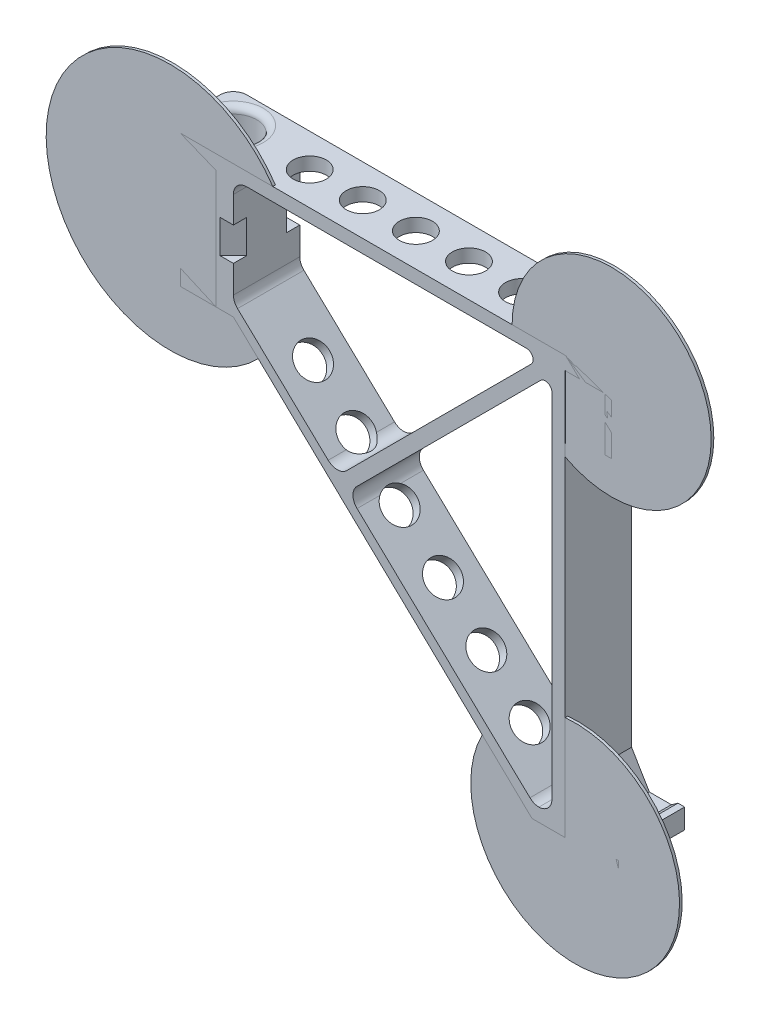
from build123d import *

# Parameters (mm, degrees)
FRAME_DEPTH         = 10
SKETCH13_R          = 3.5
CUT_EXTRUDE7_DEPTH  = 67.66634461
FILLET4_R           = 1
SKETCH14_W          = 5
SKETCH14_H          = 5
CUT_EXTRUDE8_DEPTH  = 81.777611378
FILLET5_R           = 2
CUT_EXTRUDE9_DEPTH  = 5
CHAMFER1_SIZE       = 1
FILLET6_R           = 2
FILLET7_R           = 1
CUT_EXTRUDE11_REACH = 59.656
SKETCH18_R          = 2.5
CUT_EXTRUDE12_REACH = 83.008
SKETCH19_R          = 2.5
EARS_DEPTH          = 0.4
EARS_2_DEPTH        = 0.4
EARS_3_DEPTH        = 0.4


with BuildPart() as part:
    # Sketch1 → Frame (new body)
    with BuildSketch(Plane.XY):
        Polygon((-8, 62.65), (49, 62.65), (49, 52.65), (48, 52.65), (48, 60.65), (42, 60.65), (42, 6.5), (44.7, 2), (48, 2), (49, 2.703504174), (50, 2.703504174), (50, -0.296495826), (37, -0.296495826), (-8, 42.65), (-18, 42.65), (-18, 62.65), align=None)
        Polygon((-8, 44.65), (-8, 60.65), (38.585786438, 60.65), (7.695355997, 29.759569559), align=None, mode=Mode.SUBTRACT)
        Polygon((40, 59.235786438), (40, 1.703504174), (37.268035971, 1.703504174), (9.146787391, 28.382573828), align=None, mode=Mode.SUBTRACT)
    extrude(amount=FRAME_DEPTH)

    # Sketch13 → Cut-Extrude7 (cut, through all)
    with BuildSketch(Plane.XZ.offset(-42.65)):
        with Locations(Location((-13, 5, 0), (0, 0, 270))):
            Circle(SKETCH13_R)
    extrude(amount=-CUT_EXTRUDE7_DEPTH, mode=Mode.SUBTRACT)

    # Fillet4
    fillet4_edges = [part.edges().sort_by_distance(p)[0] for p in [
        (-13, 62.65, 8.5),
        (-13, 42.65, 8.5),
    ]]
    fillet(fillet4_edges, radius=FILLET4_R)

    # Sketch14 → Cut-Extrude8 (cut, through all)
    with BuildSketch(Plane.XY.offset(10)):
        with Locations((-15.5, 52.15)):
            Rectangle(SKETCH14_W, SKETCH14_H)
    extrude(amount=-CUT_EXTRUDE8_DEPTH, mode=Mode.SUBTRACT)

    # Fillet5
    fillet5_edges = [part.edges().sort_by_distance(p)[0] for p in [
        (-18, 58.65, 0),
        (-18, 58.65, 10),
        (-18, 46.15, 0),
        (-18, 46.15, 10),
    ]]
    fillet(fillet5_edges, radius=FILLET5_R)

    # Sketch15 → Cut-Extrude9 (cut)
    with BuildSketch(Plane(origin=(0, 49.65, 0), x_dir=(1, 0, 0), z_dir=(0, 1, 0))):
        Polygon((-10, 0), (-8, -2), (-8, 0), align=None)
        Polygon((-10, -10), (-8, -8), (-8, -10), align=None)
    extrude(amount=CUT_EXTRUDE9_DEPTH, mode=Mode.SUBTRACT)

    # Chamfer1
    chamfer1_edges = [part.edges().sort_by_distance(p)[0] for p in [
        (-13, 52.15, 0),
        (-13, 52.15, 10),
    ]]
    chamfer(chamfer1_edges, length=CHAMFER1_SIZE)

    # Fillet6
    # the kernel refuses this fillet: 2 mm, written as the material it adds along each edge
    with BuildSketch(Plane(origin=(-8, 60.65, 0), x_dir=(0, -1, 0), z_dir=(0, 0, 1)), Plane(origin=(40, 1.703504174, 0), x_dir=(0, 1, 0), z_dir=(0, 0, 1))) as fillet6_piece_1:
        with BuildLine():
            CenterArc((FILLET6_R, FILLET6_R), FILLET6_R, 180, 90)
            Line((0, FILLET6_R), (0, 0))
            Line((0, 0), (FILLET6_R, 0))
        make_face()
    extrude(amount=10)
    with BuildSketch(Plane(origin=(37.268035971, 1.703504174, 0), x_dir=(1, 0, 0), z_dir=(0, 0, 1))) as fillet6_piece_2:
        with BuildLine():
            CenterArc((FILLET6_R * 0.398883640348, FILLET6_R), FILLET6_R, 226.507503973, 43.492496027)
            Line((-FILLET6_R * 0.289375927855, FILLET6_R * 0.274535482069), (0, 0))
            Line((0, 0), (FILLET6_R * 0.398883640348, 0))
        make_face()
    extrude(amount=10)
    with BuildSketch(Plane(origin=(-8, 44.65, 0), x_dir=(0, 1, 0), z_dir=(0, 0, 1))) as fillet6_piece_3:
        with BuildLine():
            CenterArc((FILLET6_R * 0.429711480151, -FILLET6_R), FILLET6_R, 90, 46.507503973)
            Line((-FILLET6_R * 0.29575303778, -FILLET6_R * 0.311740431797), (0, 0))
            Line((0, 0), (FILLET6_R * 0.429711480151, 0))
        make_face()
    extrude(amount=10)
    with BuildSketch(Plane(origin=(9.146787391, 28.382573828, 0), x_dir=(0.7254645179309741, -0.6882595682031448, 0), z_dir=(0, 0, 1))) as fillet6_piece_4:
        with BuildLine():
            CenterArc((FILLET6_R * 1.02666321267, FILLET6_R), FILLET6_R, 178.492496027, 91.507503973)
            Line((FILLET6_R * 0.0270093246389, FILLET6_R * 1.02630787225), (0, 0))
            Line((0, 0), (FILLET6_R * 1.02666321267, 0))
        make_face()
    extrude(amount=10)
    with BuildSketch(Plane(origin=(7.695355997, 29.759569559, 0), x_dir=(0.7071067811865478, 0.7071067811865474, 0), z_dir=(0, 0, 1))) as fillet6_piece_5:
        with BuildLine():
            CenterArc((FILLET6_R * 0.974029250934, FILLET6_R), FILLET6_R, 181.507503973, 88.492496027)
            Line((-FILLET6_R * 0.0256246370977, FILLET6_R * 0.973692127754), (0, 0))
            Line((0, 0), (FILLET6_R * 0.974029250934, 0))
        make_face()
    extrude(amount=10)

    # Fillet7
    fillet7_edges = [part.edges().sort_by_distance(p)[0] for p in [
        (38.585786438, 60.65, 5),
        (40, 59.235786438, 5),
    ]]
    fillet(fillet7_edges, radius=FILLET7_R)

    # Sketch18 → Cut-Extrude11 (cut, up to next)
    with BuildSketch(Plane(origin=(17.488453969, 18.324671512, 0), x_dir=(0.7234201739583832, -0.6904080329124386, 0), z_dir=(-0.6904080329124386, -0.7234201739583832, 0)), mode=Mode.PRIVATE) as cut_extrude11_sk1:
        with Locations((-26.968990252, 5)):
            Circle(SKETCH18_R)
    cut_extrude11_tool1 = extrude(cut_extrude11_sk1.sketch, amount=-CUT_EXTRUDE11_REACH, mode=Mode.PRIVATE) & part.part
    # Sketch18 → Cut-Extrude11 (cut, up to next)
    with BuildSketch(Plane(origin=(17.488453969, 18.324671512, 0), x_dir=(0.7234201739583832, -0.6904080329124386, 0), z_dir=(-0.6904080329124386, -0.7234201739583832, 0)), mode=Mode.PRIVATE) as cut_extrude11_sk2:
        with Locations((-17.968990252, 5)):
            Circle(SKETCH18_R)
    cut_extrude11_tool2 = extrude(cut_extrude11_sk2.sketch, amount=-CUT_EXTRUDE11_REACH, mode=Mode.PRIVATE) & part.part
    # Sketch18 → Cut-Extrude11 (cut, up to next)
    with BuildSketch(Plane(origin=(17.488453969, 18.324671512, 0), x_dir=(0.7234201739583832, -0.6904080329124386, 0), z_dir=(-0.6904080329124386, -0.7234201739583832, 0)), mode=Mode.PRIVATE) as cut_extrude11_sk3:
        with Locations((-8.968990252, 5)):
            Circle(SKETCH18_R)
    cut_extrude11_tool3 = extrude(cut_extrude11_sk3.sketch, amount=-CUT_EXTRUDE11_REACH, mode=Mode.PRIVATE) & part.part
    # Sketch18 → Cut-Extrude11 (cut, up to next)
    with BuildSketch(Plane(origin=(17.488453969, 18.324671512, 0), x_dir=(0.7234201739583832, -0.6904080329124386, 0), z_dir=(-0.6904080329124386, -0.7234201739583832, 0)), mode=Mode.PRIVATE) as cut_extrude11_sk4:
        with Locations((0.031009748, 5)):
            Circle(SKETCH18_R)
    cut_extrude11_tool4 = extrude(cut_extrude11_sk4.sketch, amount=-CUT_EXTRUDE11_REACH, mode=Mode.PRIVATE) & part.part
    # Sketch18 → Cut-Extrude11 (cut, up to next)
    with BuildSketch(Plane(origin=(17.488453969, 18.324671512, 0), x_dir=(0.7234201739583832, -0.6904080329124386, 0), z_dir=(-0.6904080329124386, -0.7234201739583832, 0)), mode=Mode.PRIVATE) as cut_extrude11_sk5:
        with Locations((9.031009748, 5)):
            Circle(SKETCH18_R)
    cut_extrude11_tool5 = extrude(cut_extrude11_sk5.sketch, amount=-CUT_EXTRUDE11_REACH, mode=Mode.PRIVATE) & part.part
    # Sketch18 → Cut-Extrude11 (cut, up to next)
    with BuildSketch(Plane(origin=(17.488453969, 18.324671512, 0), x_dir=(0.7234201739583832, -0.6904080329124386, 0), z_dir=(-0.6904080329124386, -0.7234201739583832, 0)), mode=Mode.PRIVATE) as cut_extrude11_sk6:
        with Locations((18.031009748, 5)):
            Circle(SKETCH18_R)
    cut_extrude11_tool6 = extrude(cut_extrude11_sk6.sketch, amount=-CUT_EXTRUDE11_REACH, mode=Mode.PRIVATE) & part.part
    add(cut_extrude11_tool1.solids().sort_by_distance((-2.021458, 36.944279, 5))[0], mode=Mode.SUBTRACT)
    add(cut_extrude11_tool2.solids().sort_by_distance((4.489324, 30.730607, 5))[0], mode=Mode.SUBTRACT)
    add(cut_extrude11_tool3.solids().sort_by_distance((11.000105, 24.516934, 5))[0], mode=Mode.SUBTRACT)
    add(cut_extrude11_tool4.solids().sort_by_distance((17.510887, 18.303262, 5))[0], mode=Mode.SUBTRACT)
    add(cut_extrude11_tool5.solids().sort_by_distance((24.021669, 12.08959, 5))[0], mode=Mode.SUBTRACT)
    add(cut_extrude11_tool6.solids().sort_by_distance((30.53245, 5.875918, 5))[0], mode=Mode.SUBTRACT)

    # Sketch19 → Cut-Extrude12 (cut, up to next)
    with BuildSketch(Plane(origin=(0, 62.65, 0), x_dir=(1, 0, 0), z_dir=(0, 1, 0)), mode=Mode.PRIVATE) as cut_extrude12_sk1:
        with Locations(Location((-1.5, -5, 0), (0, 0, 180))):
            Circle(SKETCH19_R)
    cut_extrude12_tool1 = extrude(cut_extrude12_sk1.sketch, amount=-CUT_EXTRUDE12_REACH, mode=Mode.PRIVATE) & part.part
    # Sketch19 → Cut-Extrude12 (cut, up to next)
    with BuildSketch(Plane(origin=(0, 62.65, 0), x_dir=(1, 0, 0), z_dir=(0, 1, 0)), mode=Mode.PRIVATE) as cut_extrude12_sk2:
        with Locations(Location((6.5, -5, 0), (0, 0, 180))):
            Circle(SKETCH19_R)
    cut_extrude12_tool2 = extrude(cut_extrude12_sk2.sketch, amount=-CUT_EXTRUDE12_REACH, mode=Mode.PRIVATE) & part.part
    # Sketch19 → Cut-Extrude12 (cut, up to next)
    with BuildSketch(Plane(origin=(0, 62.65, 0), x_dir=(1, 0, 0), z_dir=(0, 1, 0)), mode=Mode.PRIVATE) as cut_extrude12_sk3:
        with Locations(Location((14.5, -5, 0), (0, 0, 180))):
            Circle(SKETCH19_R)
    cut_extrude12_tool3 = extrude(cut_extrude12_sk3.sketch, amount=-CUT_EXTRUDE12_REACH, mode=Mode.PRIVATE) & part.part
    # Sketch19 → Cut-Extrude12 (cut, up to next)
    with BuildSketch(Plane(origin=(0, 62.65, 0), x_dir=(1, 0, 0), z_dir=(0, 1, 0)), mode=Mode.PRIVATE) as cut_extrude12_sk4:
        with Locations(Location((22.5, -5, 0), (0, 0, 180))):
            Circle(SKETCH19_R)
    cut_extrude12_tool4 = extrude(cut_extrude12_sk4.sketch, amount=-CUT_EXTRUDE12_REACH, mode=Mode.PRIVATE) & part.part
    # Sketch19 → Cut-Extrude12 (cut, up to next)
    with BuildSketch(Plane(origin=(0, 62.65, 0), x_dir=(1, 0, 0), z_dir=(0, 1, 0)), mode=Mode.PRIVATE) as cut_extrude12_sk5:
        with Locations(Location((30.5, -5, 0), (0, 0, 180))):
            Circle(SKETCH19_R)
    cut_extrude12_tool5 = extrude(cut_extrude12_sk5.sketch, amount=-CUT_EXTRUDE12_REACH, mode=Mode.PRIVATE) & part.part
    add(cut_extrude12_tool1.solids().sort_by_distance((-1.5, 62.65, 5))[0], mode=Mode.SUBTRACT)
    add(cut_extrude12_tool2.solids().sort_by_distance((6.5, 62.65, 5))[0], mode=Mode.SUBTRACT)
    add(cut_extrude12_tool3.solids().sort_by_distance((14.5, 62.65, 5))[0], mode=Mode.SUBTRACT)
    add(cut_extrude12_tool4.solids().sort_by_distance((22.5, 62.65, 5))[0], mode=Mode.SUBTRACT)
    add(cut_extrude12_tool5.solids().sort_by_distance((30.5, 62.65, 5))[0], mode=Mode.SUBTRACT)


with BuildPart() as body_2:
    # Sketch17 → ears (new body)
    with BuildSketch(Plane.XY.offset(10)):
        with BuildLine():
            Line((34, 62.65), (42.067253202, 62.65))
            Line((42.067253202, 62.65), (42, 49.383500839))
            ThreePointArc((42, 49.383500839), (61.845232579, 70.395966692), (34, 62.65))
        make_face()
    extrude(amount=-EARS_DEPTH)


with BuildPart() as body_3:
    # Sketch17 → ears 2 (new body)
    with BuildSketch(Plane.XY.offset(10)):
        with BuildLine():
            Line((29.494939575, 6.866082979), (37, -0.296495826))
            Line((37, -0.296495826), (42, -0.296495826))
            Line((42, -0.296495826), (42, 15.362183961))
            ThreePointArc((42, 15.362183961), (52.340116383, -13.307898324), (29.494939575, 6.866082979))
        make_face()
    extrude(amount=-EARS_2_DEPTH)


with BuildPart() as body_4:
    # Sketch17 → ears 3 (new body)
    with BuildSketch(Plane.XY.offset(10)):
        with BuildLine():
            Line((-2.067066812, 62.65), (-10.587516805, 62.65))
            Line((-10.587516805, 62.65), (-10.587516805, 42.65))
            Line((-10.587516805, 42.65), (-8, 42.65))
            Line((-8, 42.65), (-4.253195402, 39.074174932))
            ThreePointArc((-4.253195402, 39.074174932), (-36.138636082, 53.920103565), (-2.067066812, 62.65))
        make_face()
    extrude(amount=-EARS_3_DEPTH)


solid = Compound([part.part, body_2.part, body_3.part, body_4.part])
